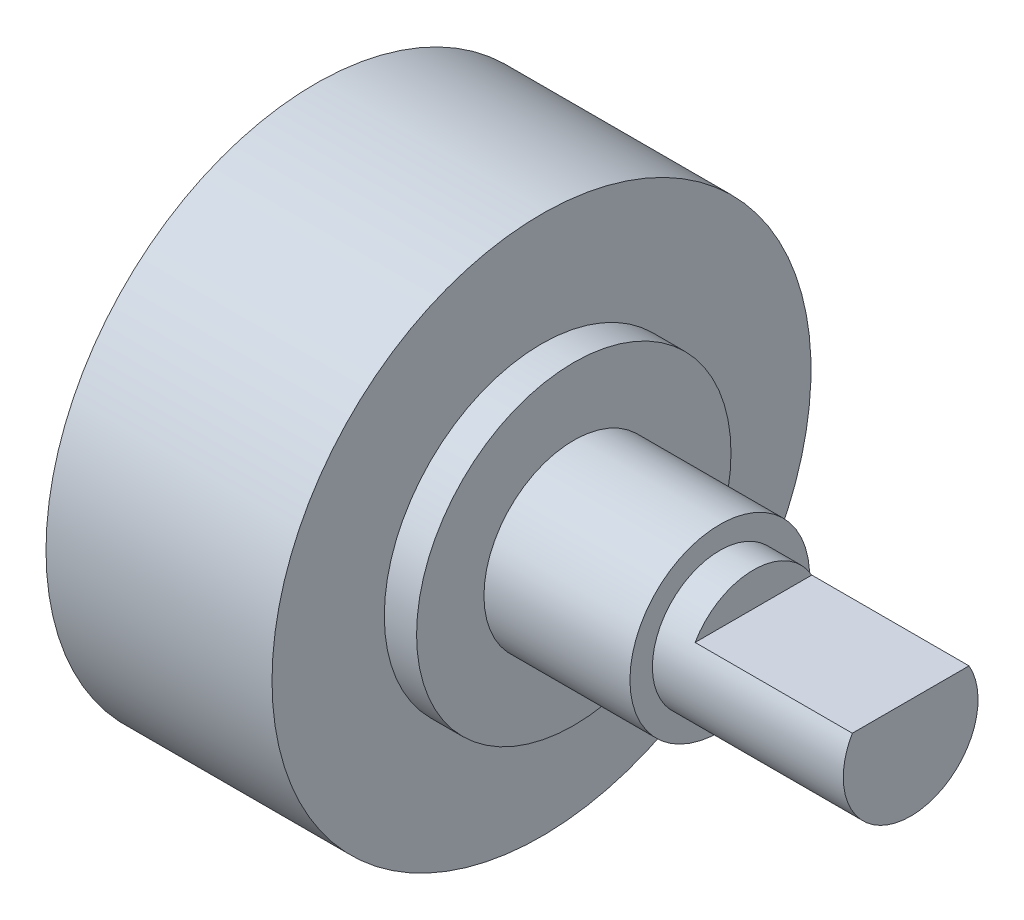
from build123d import *

# Parameters (mm, degrees)
CUT_EXTRUDE1_START = -7
CUT_EXTRUDE1_DEPTH = 7


with BuildPart() as part:
    # Sketch1 → Revolve1 (revolve)
    with BuildSketch(Plane.XY):
        Polygon((0, 0), (26.5, 0), (26.5, 3), (18, 3), (18, 4), (11.5, 4), (11.5, 7), (10.063118771, 7), (10.063118771, 12), (0, 12), align=None)
    revolve(axis=Axis((0, 0, 0), (1, 0, 0)))

    # Sketch2 → Cut-Extrude1 (cut)
    with BuildSketch(Plane(origin=(26.5, 0, 0), x_dir=(0, 0, -1), z_dir=(1, 0, 0)).offset(CUT_EXTRUDE1_START)):
        with BuildLine():
            Line((-2.598076211, 1.5), (2.598076211, 1.5))
            ThreePointArc((2.598076211, 1.5), (0, 3), (-2.598076211, 1.5))
        make_face()
    extrude(amount=CUT_EXTRUDE1_DEPTH, mode=Mode.SUBTRACT)


solid = part.part
